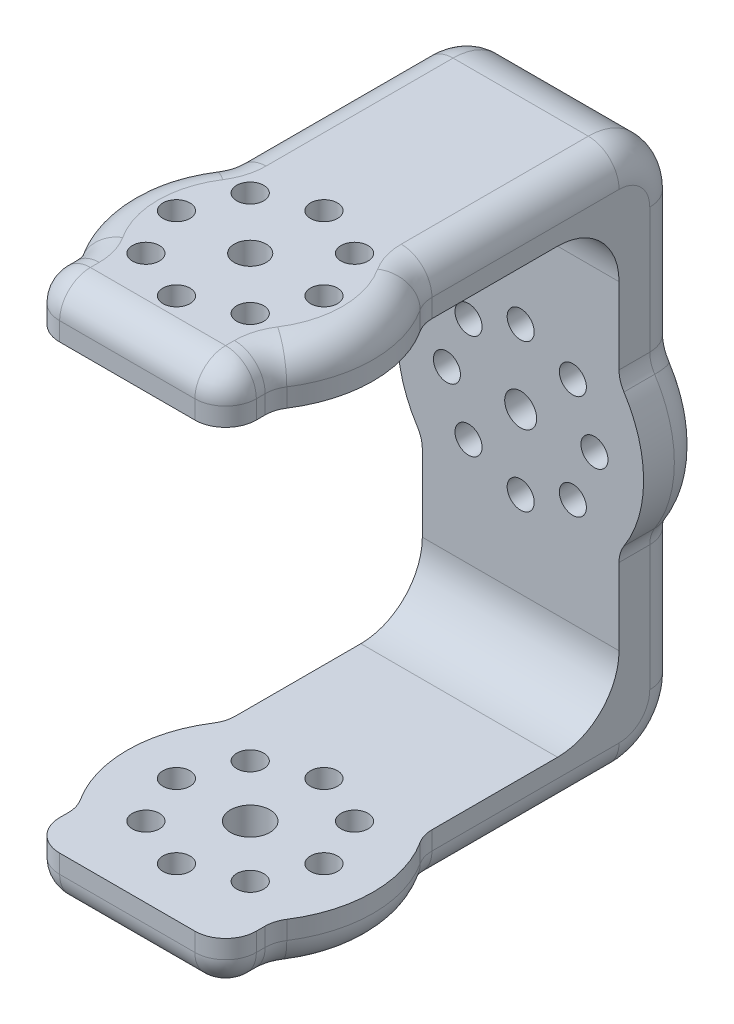
from build123d import *

# Parameters (mm, degrees)
SKETCH_1_R      = 1.3
SKETCH_1_R_2    = 1.1
EXTRUDE_1_DEPTH = 5
SKETCH_2_R      = 1.6
SKETCH_2_R_2    = 1.1
EXTRUDE_2_DEPTH = 4
EXTRUDE_START   = 4
SKETCH_3_R      = 1.1
SKETCH_3_R_2    = 1.3
EXTRUDE_3_DEPTH = 4
FILLET_1_R      = 5
FILLET_2_R      = 2.5
FILLET_3_R      = 2.5


with BuildPart() as part:
    # ｽｹｯﾁ1 → ﾎﾞｽ - 押し出し1 (new body)
    with BuildSketch(Plane.XY):
        with BuildLine():
            Line((-8, 0), (8, 0))
            Line((8, 0), (8, 12))
            ThreePointArc((8, 12), (10, 18), (8, 24))
            Line((8, 24), (8, 36))
            Line((8, 36), (-8, 36))
            Line((-8, 36), (-8, 24))
            ThreePointArc((-8, 24), (-10, 18), (-8, 12))
            Line((-8, 12), (-8, 0))
        make_face()
        with Locations((0, 18)):
            Circle(SKETCH_1_R, mode=Mode.SUBTRACT)
        with Locations((0, 24)):
            Circle(SKETCH_1_R_2, mode=Mode.SUBTRACT)
        with Locations((4.242640687, 22.242640687)):
            Circle(SKETCH_1_R_2, mode=Mode.SUBTRACT)
        with Locations((6, 18)):
            Circle(SKETCH_1_R_2, mode=Mode.SUBTRACT)
        with Locations((4.242640687, 13.757359313)):
            Circle(SKETCH_1_R_2, mode=Mode.SUBTRACT)
        with Locations((0, 12)):
            Circle(SKETCH_1_R_2, mode=Mode.SUBTRACT)
        with Locations((-4.242640687, 13.757359313)):
            Circle(SKETCH_1_R_2, mode=Mode.SUBTRACT)
        with Locations((-6, 18)):
            Circle(SKETCH_1_R_2, mode=Mode.SUBTRACT)
        with Locations((-4.242640687, 22.242640687)):
            Circle(SKETCH_1_R_2, mode=Mode.SUBTRACT)
    extrude(amount=EXTRUDE_1_DEPTH)

    # ｽｹｯﾁ2 → ﾎﾞｽ - 押し出し2 (add)
    with BuildSketch(Plane.XZ):
        with BuildLine():
            Line((-8, 0), (8, 0))
            Line((8, 0), (8, 21))
            ThreePointArc((8, 21), (10, 27), (8, 33))
            Line((8, 33), (8, 37))
            Line((8, 37), (-8, 37))
            Line((-8, 37), (-8, 33))
            ThreePointArc((-8, 33), (-10, 27), (-8, 21))
            Line((-8, 21), (-8, 0))
        make_face()
        with Locations((0, 27)):
            Circle(SKETCH_2_R, mode=Mode.SUBTRACT)
        with Locations((6, 27)):
            Circle(SKETCH_2_R_2, mode=Mode.SUBTRACT)
        with Locations((4.242640687, 22.757359313)):
            Circle(SKETCH_2_R_2, mode=Mode.SUBTRACT)
        with Locations((0, 21)):
            Circle(SKETCH_2_R_2, mode=Mode.SUBTRACT)
        with Locations((-4.242640687, 22.757359313)):
            Circle(SKETCH_2_R_2, mode=Mode.SUBTRACT)
        with Locations((-6, 27)):
            Circle(SKETCH_2_R_2, mode=Mode.SUBTRACT)
        with Locations((-4.242640687, 31.242640687)):
            Circle(SKETCH_2_R_2, mode=Mode.SUBTRACT)
        with Locations((0, 33)):
            Circle(SKETCH_2_R_2, mode=Mode.SUBTRACT)
        with Locations((4.242640687, 31.242640687)):
            Circle(SKETCH_2_R_2, mode=Mode.SUBTRACT)
    extrude(amount=EXTRUDE_2_DEPTH)

    # ｽｹｯﾁ3 → ﾎﾞｽ - 押し出し3 (add)
    with BuildSketch(Plane(origin=(0, 36, 0), x_dir=(1, 0, 0), z_dir=(0, 1, 0)).offset(EXTRUDE_START)):
        with BuildLine():
            Line((8, -5), (8, 0))
            Line((8, 0), (-8, 0))
            Line((-8, 0), (-8, -5))
            Line((-8, -5), (-8, -21))
            ThreePointArc((-8, -21), (-10, -27), (-8, -33))
            Line((-8, -33), (-8, -37))
            Line((-8, -37), (8, -37))
            Line((8, -37), (8, -33))
            ThreePointArc((8, -33), (10, -27), (8, -21))
            Line((8, -21), (8, -5))
        make_face()
        with Locations((4.242640687, -22.757359313)):
            Circle(SKETCH_3_R, mode=Mode.SUBTRACT)
        with Locations((0, -21)):
            Circle(SKETCH_3_R, mode=Mode.SUBTRACT)
        with Locations((-4.242640687, -22.757359313)):
            Circle(SKETCH_3_R, mode=Mode.SUBTRACT)
        with Locations((-6, -27)):
            Circle(SKETCH_3_R, mode=Mode.SUBTRACT)
        with Locations((-4.242640687, -31.242640687)):
            Circle(SKETCH_3_R, mode=Mode.SUBTRACT)
        with Locations((0, -33)):
            Circle(SKETCH_3_R, mode=Mode.SUBTRACT)
        with Locations((4.242640687, -31.242640687)):
            Circle(SKETCH_3_R, mode=Mode.SUBTRACT)
        with Locations((6, -27)):
            Circle(SKETCH_3_R, mode=Mode.SUBTRACT)
        with Locations((0, -27)):
            Circle(SKETCH_3_R_2, mode=Mode.SUBTRACT)
    extrude(amount=-EXTRUDE_3_DEPTH)

    # ﾌｨﾚｯﾄ1
    fillet_1_edges = [part.edges().sort_by_distance(p)[0] for p in [
        (0, 40, 0),
        (0, -4, 0),
        (0, 0, 5),
        (0, 36, 5),
    ]]
    fillet(fillet_1_edges, radius=FILLET_1_R)

    # ﾌｨﾚｯﾄ2
    fillet_2_edges = [part.edges().sort_by_distance(p)[0] for p in [
        (8, 12, 2.5),
        (8, 24, 2.5),
        (8, 38, 21),
        (8, 38, 33),
        (8, 38, 37),
        (-8, 38, 37),
        (-8, 38, 33),
        (-8, 38, 21),
        (-8, 24, 2.5),
        (-8, 12, 2.5),
        (-8, -2, 21),
        (-8, -2, 33),
        (-8, -2, 37),
        (8, -2, 37),
        (8, -2, 21),
        (8, -2, 33),
    ]]
    fillet(fillet_2_edges, radius=FILLET_2_R)

    # ﾌｨﾚｯﾄ3
    fillet_3_edges = [part.edges().sort_by_distance(p)[0] for p in [
        (8, -2.535533906, 1.464466094),
        (8, -4, 12.608835008),
        (8.102084238, -4, 20.924776798),
        (10, -4, 27),
        (8.102084238, -4, 33.075223202),
        (8, -4, 34.141164992),
        (7.267766953, -4, 36.267766953),
        (0, -4, 37),
        (-7.267766953, -4, 36.267766953),
        (-8, -4, 34.141164992),
        (-8.102084238, -4, 33.075223202),
        (-10, -4, 27),
        (-8.102084238, -4, 20.924776798),
        (-8, -4, 12.608835008),
        (-8, -2.535533906, 1.464466094),
        (-8, 6.108835008, 0),
        (-8.102084238, 11.924776798, 0),
        (-10, 18, 0),
        (-8.102084238, 24.075223202, 0),
        (-8, 29.891164992, 0),
        (-8, 38.535533906, 1.464466094),
        (-8, 40, 12.608835008),
        (-8.102084238, 40, 20.924776798),
        (-10, 40, 27),
        (-8.102084238, 40, 33.075223202),
        (-8, 40, 34.141164992),
        (-7.267766953, 40, 36.267766953),
        (0, 40, 37),
        (7.267766953, 40, 36.267766953),
        (8, 40, 34.141164992),
        (8.102084238, 40, 33.075223202),
        (10, 40, 27),
        (8.102084238, 40, 20.924776798),
        (8, 40, 12.608835008),
        (8, 38.535533906, 1.464466094),
        (8, 29.891164992, 0),
        (8.102084238, 24.075223202, 0),
        (10, 18, 0),
        (8.102084238, 11.924776798, 0),
        (8, 6.108835008, 0),
    ]]
    fillet(fillet_3_edges, radius=FILLET_3_R)


solid = part.part
